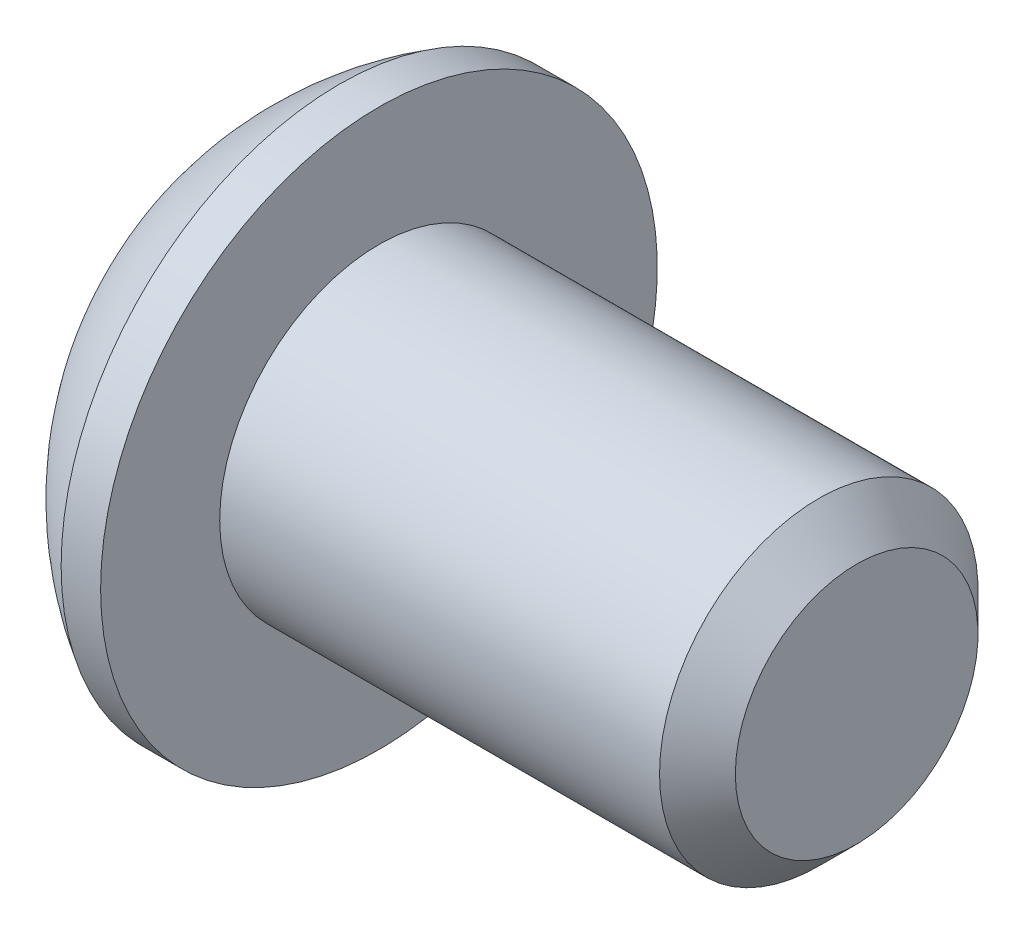
from build123d import *

# Parameters (mm, degrees)
HEX_2_DEPTH = 2.2098


with BuildPart() as part:
    # BodySke → BaseBody (revolve)
    with BuildSketch(Plane.XY):
        with BuildLine():
            Line((12.8778, 0), (12.8778, 2.41935))
            Line((12.8778, 2.41935), (12.12215, 3.175))
            Line((12.12215, 3.175), (3.3528, 3.175))
            Line((3.3528, 3.175), (3.3528, 5.5499))
            Line((3.3528, 5.5499), (2.5654, 5.5499))
            ThreePointArc((2.5654, 5.5499), (1.073764503, 4.355582759), (0, 2.77495))
            Line((0, 2.77495), (0, 0))
            Line((0, 0), (12.8778, 0))
        make_face()
    revolve(axis=Axis((0, 0, 0), (1, 0, 0)))

    # Sketch2 → PreBroach (revolve, cut)
    with BuildSketch(Plane.XY):
        Polygon((0, 1.9812), (2.2098, 1.9812), (3.353646353, 0), (0, 0), align=None)
    revolve(axis=Axis((0, 0, 0), (1, 0, 0)), mode=Mode.SUBTRACT)

    # Sketch3 → Hex 2 (cut)
    with BuildSketch(Plane(origin=(0, 0, 0), x_dir=(0, 0, -1), z_dir=(1, 0, 0))):
        Polygon((-1.9812, -1.143846353), (-1.9812, 1.143846353), (0, 2.287692707), (1.9812, 1.143846353), (1.9812, -1.143846353), (0, -2.287692707), align=None)
    extrude(amount=HEX_2_DEPTH, mode=Mode.SUBTRACT)


solid = part.part
